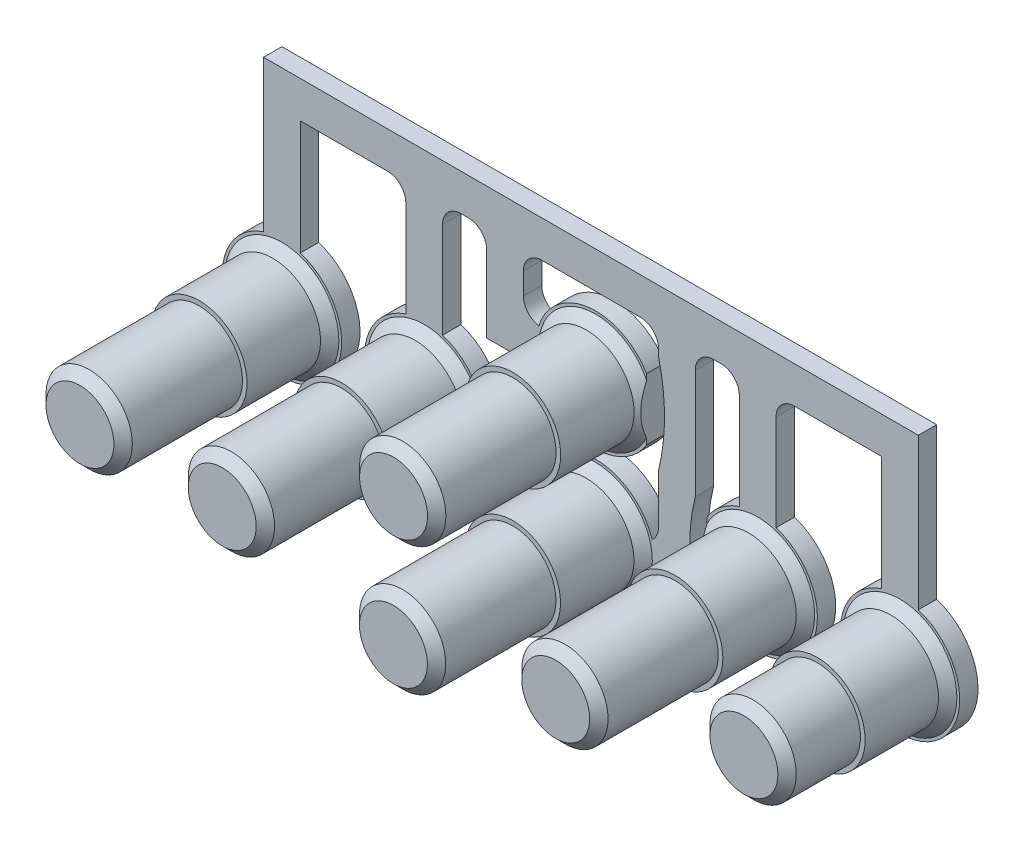
from build123d import *

# Parameters (mm, degrees)
SKIZZE1_R                            = 2.35
AUFSATZ_LINEAR_AUSTRAGEN1_DEPTH      = 12
AUFSATZ_LINEAR_AUSTRAGEN1_2_DEPTH    = 12
AUFSATZ_LINEAR_AUSTRAGEN1_3_DEPTH    = 12
AUFSATZ_LINEAR_AUSTRAGEN1_4_DEPTH    = 12
AUFSATZ_LINEAR_AUSTRAGEN1_5_DEPTH    = 12
SKIZZE1_3_R                          = 2.35
AUFSATZ_LINEAR_AUSTRAGEN4_DEPTH      = 9.5
SKIZZE2_R                            = 3.25
AUFSATZ_LINEAR_AUSTRAGEN2_DEPTH      = 1
AUFSATZ_LINEAR_AUSTRAGEN3_DEPTH      = 1
SKIZZE5_R                            = 2.6
AUFSATZ_LINEAR_AUSTRAGEN5_DEPTH      = 4.5
FASE1_SIZE                           = 0.5
FASE2_SIZE                           = 0.5
FASE3_SIZE                           = 0.5
SCHNITT_LINEAR_AUSTRAGEN1_DEPTH      = 7
SCHNITT_LINEAR_AUSTRAGEN1_DEPTH_BACK = 27.592507318
VERRUNDUNG1_R                        = 1


with BuildPart() as part:
    # Skizze1 → Aufsatz-Linear austragen1 (new body)
    with BuildSketch(Plane.XY):
        with Locations((-17.068817434, 1.838554139)):
            Circle(SKIZZE1_R)
    extrude(amount=AUFSATZ_LINEAR_AUSTRAGEN1_DEPTH)



with BuildPart() as body_2:
    # Skizze1 → Aufsatz-Linear austragen1 2 (new body)
    with BuildSketch(Plane.XY):
        with Locations((-9.321817434, 1.838554139)):
            Circle(SKIZZE1_R)
    extrude(amount=AUFSATZ_LINEAR_AUSTRAGEN1_2_DEPTH)


with BuildPart() as body_3:
    # Skizze1 → Aufsatz-Linear austragen1 3 (new body)
    with BuildSketch(Plane.XY):
        Circle(SKIZZE1_R)
    extrude(amount=AUFSATZ_LINEAR_AUSTRAGEN1_3_DEPTH)


with BuildPart() as body_4:
    # Skizze1 → Aufsatz-Linear austragen1 4 (new body)
    with BuildSketch(Plane.XY):
        with Locations((0.007570249, 6.993531953)):
            Circle(SKIZZE1_R)
    extrude(amount=AUFSATZ_LINEAR_AUSTRAGEN1_4_DEPTH)


with BuildPart() as body_5:
    # Skizze1 → Aufsatz-Linear austragen1 5 (new body)
    with BuildSketch(Plane.XY):
        with Locations((8.839182566, 1.838554139)):
            Circle(SKIZZE1_R)
    extrude(amount=AUFSATZ_LINEAR_AUSTRAGEN1_5_DEPTH)


with BuildPart() as body_6:
    # Skizze1<3> → Aufsatz-Linear austragen4 (new body)
    with BuildSketch(Plane.XY):
        with Locations((16.586182566, 1.838554139)):
            Circle(SKIZZE1_3_R)
    extrude(amount=AUFSATZ_LINEAR_AUSTRAGEN4_DEPTH)


with BuildPart() as part_1:
    add(part.part)

    add(body_2.part)  # Aufsatz-Linear austragen2 merges body 2

    add(body_3.part)  # Aufsatz-Linear austragen2 merges body 3

    add(body_4.part)  # Aufsatz-Linear austragen2 merges body 4

    add(body_5.part)  # Aufsatz-Linear austragen2 merges body 5

    add(body_6.part)  # Aufsatz-Linear austragen2 merges body 6
    # Skizze2 → Aufsatz-Linear austragen2 (add)
    with BuildSketch(Plane.XY):
        with Locations((-17.068817434, 1.838554139)):
            Circle(SKIZZE2_R)
        with Locations((-9.321817434, 1.838554139)):
            Circle(SKIZZE2_R)
        Circle(SKIZZE2_R)
        with Locations((0.007570249, 6.993531953)):
            Circle(SKIZZE2_R)
        with Locations((8.839182566, 1.838554139)):
            Circle(SKIZZE2_R)
        with Locations((16.586182566, 1.838554139)):
            Circle(SKIZZE2_R)
    extrude(amount=AUFSATZ_LINEAR_AUSTRAGEN2_DEPTH)

    # Skizze3 → Aufsatz-Linear austragen3 (add)
    with BuildSketch(Plane.XY):
        Polygon((-18.068817434, 13.164615586), (-18.068817434, 4.930883358), (-16.068817434, 4.930883358), (-16.068817434, 11.164615586), (-10.321817434, 11.164615586), (-10.321817434, 4.930883358), (-8.321817434, 4.930883358), (-8.321817434, 11.164615586), (-5.921817434, 11.164615586), (-5.921817434, 5.993531953), (-3.08475897, 5.993531953), (-3.08475897, 7.993531953), (-3.921817434, 7.993531953), (-3.921817434, 11.164615586), (3.439182566, 11.164615586), (3.439182566, 1), (3.092329219, 1), (3.092329219, -1), (3.439182566, -1), (5.439182566, -1), (5.439182566, 1), (5.439182566, 11.164615586), (7.839182566, 11.164615586), (7.839182566, 4.930883358), (9.839182566, 4.930883358), (9.839182566, 11.164615586), (15.586182566, 11.164615586), (15.586182566, 4.930883358), (17.586182566, 4.930883358), (17.586182566, 13.164615586), align=None)
    extrude(amount=AUFSATZ_LINEAR_AUSTRAGEN3_DEPTH)

    # Skizze5 → Aufsatz-Linear austragen5 (add)
    with BuildSketch(Plane.XY.offset(1)):
        with Locations((-17.068817434, 1.838554139)):
            Circle(SKIZZE5_R)
        with Locations((-9.321817434, 1.838554139)):
            Circle(SKIZZE5_R)
        with Locations((0.007570249, 6.993531953)):
            Circle(SKIZZE5_R)
        Circle(SKIZZE5_R)
        with Locations((8.839182566, 1.838554139)):
            Circle(SKIZZE5_R)
        with Locations((16.586182566, 1.838554139)):
            Circle(SKIZZE5_R)
    extrude(amount=AUFSATZ_LINEAR_AUSTRAGEN5_DEPTH)

    # Fase1
    fase1_edges = [part_1.edges().sort_by_distance(p)[0] for p in [
        (-19.418817434, 1.838554139, 12),
        (-2.35, 0, 12),
        (-2.342429751, 6.993531953, 12),
        (6.489182566, 1.838554139, 12),
        (-11.671817434, 1.838554139, 12),
    ]]
    chamfer(fase1_edges, length=FASE1_SIZE)

    # Fase2
    fase2_edges = [part_1.edges().sort_by_distance(p)[0] for p in [
        (-19.668817434, 1.838554139, 1),
        (-11.921817434, 1.838554139, 1),
        (-2.592429751, 6.993531953, 1),
        (-2.6, 0, 1),
        (6.239182566, 1.838554139, 1),
        (13.986182566, 1.838554139, 1),
    ]]
    chamfer(fase2_edges, length=FASE2_SIZE)

    # Fase3
    fase3_edges = [part_1.edges().sort_by_distance(p)[0] for p in [
        (14.236182566, 1.838554139, 9.5),
    ]]
    chamfer(fase3_edges, length=FASE3_SIZE)

    # Skizze6 → Schnitt-Linear austragen1 (cut, two sides: drawn at the far end of the back side and taken through both)
    with BuildSketch(Plane.XY.offset(1).offset(-SCHNITT_LINEAR_AUSTRAGEN1_DEPTH_BACK)):
        with BuildLine():
            Line((2.789182566, 9.801413918), (2.789182566, 4.443241997))
            Line((2.789182566, 4.443241997), (3.439182566, 4.443241997))
            ThreePointArc((3.439182566, 4.443241997), (3.764166783, 7.122327957), (3.439182566, 9.801413918))
            Line((3.439182566, 9.801413918), (2.789182566, 9.801413918))
        make_face()
        with BuildLine():
            Line((6.089182566, 4.189181846), (6.089182566, -0.607667928))
            Line((6.089182566, -0.607667928), (5.439182566, -0.607667928))
            ThreePointArc((5.439182566, -0.607667928), (5.136833773, 1.790756959), (5.439182566, 4.189181846))
            Line((5.439182566, 4.189181846), (6.089182566, 4.189181846))
        make_face()
    extrude(amount=SCHNITT_LINEAR_AUSTRAGEN1_DEPTH + SCHNITT_LINEAR_AUSTRAGEN1_DEPTH_BACK, mode=Mode.SUBTRACT)

    # Verrundung1
    # the kernel refuses this fillet: 1 mm, written as the material it adds along each edge
    with BuildSketch(Plane(origin=(3.439182566, 1, 0), x_dir=(-1, 0, 0), z_dir=(0, 0, 1))) as verrundung1_piece_1:
        with BuildLine():
            CenterArc((1, -0.757231437), VERRUNDUNG1_R, 130.779268334, 49.220731666)
            Line((0, -0.757231437), (-0.02, -0.757231437))
            Line((-0.02, -0.757231437), (-0.02, 0))
            Line((-0.02, 0), (0, 0.02))
            ThreePointArc((0, 0.02), (0.173426673, 0.02), (0.333790414, 0.015144629))
            Line((0.333790414, 0.015144629), (0.346853347, 0))
        make_face()
    extrude(amount=1)
    with BuildSketch(Plane(origin=(9.839182566, 11.164615586, 0), x_dir=(1, 0, 0), z_dir=(0, 0, 1)), Plane(origin=(7.839182566, 11.164615586, 0), x_dir=(0, -1, 0), z_dir=(0, 0, 1)), Plane(origin=(3.439182566, 11.164615586, 0), x_dir=(0, -1, 0), z_dir=(0, 0, 1)), Plane(origin=(5.439182566, 11.164615586, 0), x_dir=(1, 0, 0), z_dir=(0, 0, 1)), Plane(origin=(-10.321817434, 11.164615586, 0), x_dir=(0, -1, 0), z_dir=(0, 0, 1)), Plane(origin=(-8.321817434, 11.164615586, 0), x_dir=(1, 0, 0), z_dir=(0, 0, 1)), Plane(origin=(-3.921817434, 11.164615586, 0), x_dir=(1, 0, 0), z_dir=(0, 0, 1)), Plane(origin=(-5.921817434, 11.164615586, 0), x_dir=(0, -1, 0), z_dir=(0, 0, 1))) as verrundung1_piece_2:
        with BuildLine():
            CenterArc((VERRUNDUNG1_R, -VERRUNDUNG1_R), VERRUNDUNG1_R, 90, 90)
            Line((0, -VERRUNDUNG1_R), (-VERRUNDUNG1_R * 0.02, -VERRUNDUNG1_R))
            Line((-VERRUNDUNG1_R * 0.02, -VERRUNDUNG1_R), (-VERRUNDUNG1_R * 0.02, VERRUNDUNG1_R * 0.02))
            Line((-VERRUNDUNG1_R * 0.02, VERRUNDUNG1_R * 0.02), (VERRUNDUNG1_R, VERRUNDUNG1_R * 0.02))
            Line((VERRUNDUNG1_R, VERRUNDUNG1_R * 0.02), (VERRUNDUNG1_R, 0))
        make_face()
    extrude(amount=1)
    with BuildSketch(Plane(origin=(-3.921817434, 7.993531953, 0), x_dir=(0, 1, 0), z_dir=(0, 0, 1))) as verrundung1_piece_3:
        with BuildLine():
            CenterArc((0.986635726, -1), VERRUNDUNG1_R, 90, 80.622325088)
            Line((0, -0.837058464), (-0.019732715, -0.833799634))
            ThreePointArc((-0.019732715, -0.833799634), (-0.02, -0.418529232), (-0.02, 0))
            Line((-0.02, 0), (0, 0.02))
            Line((0, 0.02), (0.986635726, 0.02))
            Line((0.986635726, 0.02), (0.986635726, 0))
        make_face()
    extrude(amount=1)
    # the kernel refuses this fillet: 1 mm, written as the material it takes off along each edge
    with BuildSketch(Plane(origin=(5.439182566, -1, -1.985478044), x_dir=(0, 1, 0), z_dir=(0, 0, 1))) as verrundung1_2_piece_1:
        with BuildLine():
            CenterArc((1, 0.794191217), VERRUNDUNG1_R, 180, 52.578930711)
            Line((0, 0.794191217), (-0.02, 0.794191217))
            Line((-0.02, 0.794191217), (-0.02, 0))
            Line((-0.02, 0), (0, -0.02))
            ThreePointArc((0, -0.02), (0.196166036, -0.02), (0.380178714, -0.015883824))
            Line((0.380178714, -0.015883824), (0.392332072, 0))
        make_face()
    extrude(amount=4.970956087, mode=Mode.SUBTRACT)


solid = part_1.part
